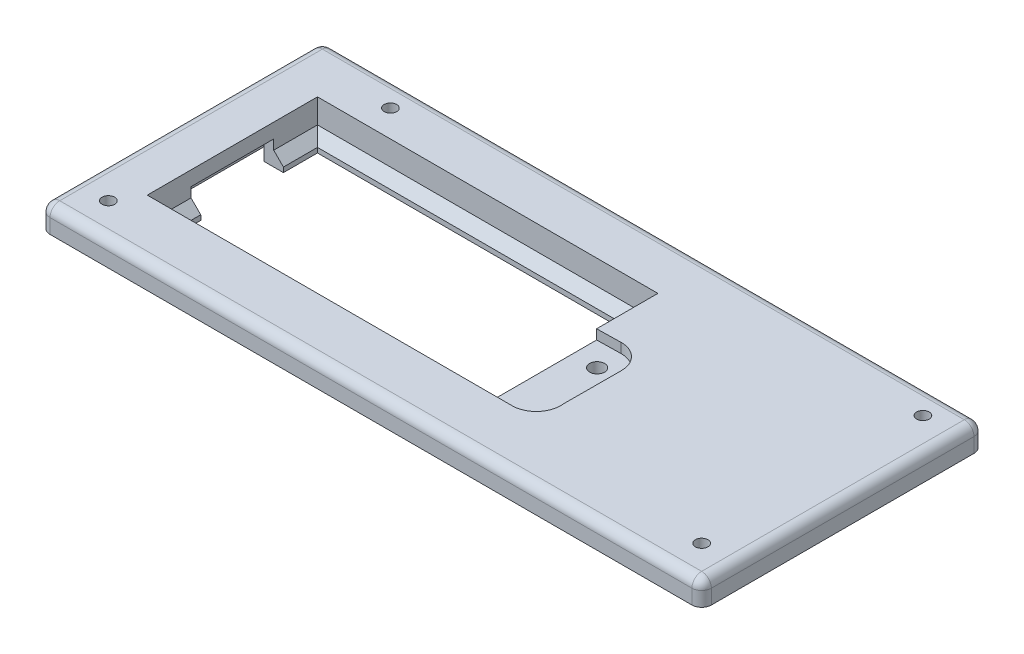
from build123d import *

# Parameters (mm, degrees)
SKETCH1_W               = 172.72
SKETCH1_H               = 73.66
SKETCH1_R               = 1.63195
BOSS_EXTRUDE1_DEPTH     = 6.35
SKETCH2_W               = 88.9
SKETCH2_H               = 44.45
CUT_EXTRUDE1_DEPTH      = 6.35
FILLET1_R               = 2.54
BOSS_EXTRUDE2_DEPTH     = 3.81
CHAMFER1_SIZE           = 2.54
CHAMFER2_SIZE           = 2.54
CUT_EXTRUDE3_DEPTH      = 189.045791232
CUT_EXTRUDE3_DEPTH_BACK = 2.54
CUT_EXTRUDE4_DEPTH      = 189.045791232
CUT_EXTRUDE4_DEPTH_BACK = 2.54
SKETCH8_R               = 5.08
BOSS_EXTRUDE3_DEPTH     = 2.54
SKETCH9_R               = 1.9685
CUT_EXTRUDE5_DEPTH      = 6.35
SKETCH10_W              = 134.62
SKETCH10_H              = 2.54
SKETCH10_W_2            = 114.3
SKETCH10_W_3            = 2.54
SKETCH10_H_2            = 35.56
SKETCH10_H_3            = 52.197
SKETCH10_W_4            = 6.35
BOSS_EXTRUDE4_DEPTH     = 3.81
FILLET2_R               = 2.54


with BuildPart() as part:
    # Sketch1 → Boss-Extrude1 (new body)
    with BuildSketch(Plane(origin=(0, 0, 0), x_dir=(1, 0, 0), z_dir=(0, 1, 0))):
        with Locations((86.36, 36.83)):
            Rectangle(SKETCH1_W, SKETCH1_H)
        with Locations(Location((24.765, 66.675, 0), (0, 0, 270))):
            Circle(SKETCH1_R, mode=Mode.SUBTRACT)
        with Locations(Location((8.89, 8.89, 0), (0, 0, 270))):
            Circle(SKETCH1_R, mode=Mode.SUBTRACT)
        with Locations(Location((163.83, 66.675, 0), (0, 0, 270))):
            Circle(SKETCH1_R, mode=Mode.SUBTRACT)
        with Locations(Location((163.83, 8.89, 0), (0, 0, 270))):
            Circle(SKETCH1_R, mode=Mode.SUBTRACT)
    extrude(amount=BOSS_EXTRUDE1_DEPTH)

    # Sketch2 → Cut-Extrude1 (cut)
    with BuildSketch(Plane(origin=(0, 6.35, 0), x_dir=(1, 0, 0), z_dir=(0, 1, 0))):
        with Locations((57.15, 37.465)):
            Rectangle(SKETCH2_W, SKETCH2_H)
    extrude(amount=-CUT_EXTRUDE1_DEPTH, mode=Mode.SUBTRACT)

    # Fillet1
    fillet1_edges = [part.edges().sort_by_distance(p)[0] for p in [
        (172.72, 6.35, -36.83),
        (86.36, 6.35, -73.66),
        (0, 6.35, -36.83),
        (0, 3.175, -73.66),
        (172.72, 3.175, -73.66),
        (172.72, 3.175, 0),
        (0, 3.175, 0),
        (86.36, 6.35, 0),
    ]]
    fillet(fillet1_edges, radius=FILLET1_R)

    # Sketch3 → Boss-Extrude2 (add)
    with BuildSketch(Plane.XZ):
        Polygon((10.16, -12.7), (104.14, -12.7), (104.14, -17.78), (15.24, -17.78), (15.24, -26.67), (10.16, -26.67), align=None)
        Polygon((10.16, -62.23), (104.14, -62.23), (104.14, -57.15), (15.24, -57.15), (15.24, -48.26), (10.16, -48.26), align=None)
    extrude(amount=BOSS_EXTRUDE2_DEPTH)

    # Chamfer1
    chamfer1_edges = [part.edges().sort_by_distance(p)[0] for p in [
        (12.7, 0, -37.465),
    ]]
    chamfer(chamfer1_edges, length=CHAMFER1_SIZE)

    # Chamfer2
    chamfer2_edges = [part.edges().sort_by_distance(p)[0] for p in [
        (58.42, 0, -17.78),
        (15.24, 0, -22.225),
        (15.24, 0, -52.705),
        (58.42, 0, -57.15),
    ]]
    chamfer(chamfer2_edges, length=CHAMFER2_SIZE - 0.0001)  # a hair under: the kernel refuses the full size

    # Sketch6 → Cut-Extrude3 (cut, two sides: drawn at the far end of the back side and taken through both)
    with BuildSketch(Plane(origin=(0, 6.35, 0), x_dir=(1, 0, 0), z_dir=(0, 1, 0)).offset(-CUT_EXTRUDE3_DEPTH_BACK)):
        with BuildLine():
            ThreePointArc((114.299859558, 37.422767419), (112.462469481, 41.932674919), (107.971116407, 43.814964889))
            Line((107.971116407, 43.814964889), (107.928883593, 43.814964889))
            ThreePointArc((107.928883593, 43.814964889), (103.452412358, 41.947656066), (101.6, 37.465))
            Line((101.6, 37.465), (101.6, 21.589866304))
            ThreePointArc((101.6, 21.589866304), (103.329230599, 17.234296291), (107.575115004, 15.250942007))
            Line((107.575115004, 15.250942007), (108.348372102, 15.252374712))
            ThreePointArc((108.348372102, 15.252374712), (112.842425973, 17.541821331), (114.250015644, 22.385041059))
            Line((114.250015644, 22.385041059), (114.299859558, 37.422767419))
        make_face()
    extrude(amount=CUT_EXTRUDE3_DEPTH + CUT_EXTRUDE3_DEPTH_BACK, mode=Mode.SUBTRACT)

    # Sketch7 → Cut-Extrude4 (cut, two sides: drawn at the far end of the back side and taken through both)
    with BuildSketch(Plane(origin=(0, 6.35, 0), x_dir=(1, 0, 0), z_dir=(0, 1, 0)).offset(-CUT_EXTRUDE4_DEPTH_BACK)):
        with BuildLine():
            Line((101.6, 43.68515436), (101.6, 37.465))
            ThreePointArc((101.6, 37.465), (103.362031135, 41.855107253), (107.670249351, 43.808834769))
            Line((107.670249351, 43.808834769), (101.6, 43.68515436))
        make_face()
        with BuildLine():
            ThreePointArc((107.563787548, 15.251622072), (103.325340603, 17.238426833), (101.6, 21.589866304))
            Line((101.6, 21.589866304), (101.6, 15.24))
            Line((101.6, 15.24), (107.563787548, 15.251622072))
        make_face()
    extrude(amount=CUT_EXTRUDE4_DEPTH + CUT_EXTRUDE4_DEPTH_BACK, mode=Mode.SUBTRACT)

    # Sketch8 → Boss-Extrude3 (add)
    with BuildSketch(Plane.XZ):
        with Locations(Location((107.95, -37.465, 0), (0, 0, 90))):
            Circle(SKETCH8_R)
    extrude(amount=BOSS_EXTRUDE3_DEPTH)

    # Sketch9 → Cut-Extrude5 (cut)
    with BuildSketch(Plane.XZ.offset(2.54)):
        with Locations(Location((107.95, -37.465, 0), (0, 0, 270))):
            Circle(SKETCH9_R)
    extrude(amount=-CUT_EXTRUDE5_DEPTH, mode=Mode.SUBTRACT)

    # Sketch10 → Boss-Extrude4 (add)
    with BuildSketch(Plane.XZ):
        with Locations((86.36, -5.588)):
            Rectangle(SKETCH10_W, SKETCH10_H)
        with Locations((96.52, -69.977)):
            Rectangle(SKETCH10_W_2, SKETCH10_H)
        with Locations((167.132, -36.83)):
            Rectangle(SKETCH10_W_3, SKETCH10_H_2)
        with Locations((5.588, -45.1485)):
            Rectangle(SKETCH10_W_3, SKETCH10_H_3)
        with Locations((10.033, -69.977)):
            Rectangle(SKETCH10_W_4, SKETCH10_H)
    extrude(amount=BOSS_EXTRUDE4_DEPTH)

    # Fillet2
    fillet2_edges = [part.edges().sort_by_distance(p)[0] for p in [
        (4.318, -1.905, -71.247),
    ]]
    fillet(fillet2_edges, radius=FILLET2_R)


solid = part.part
